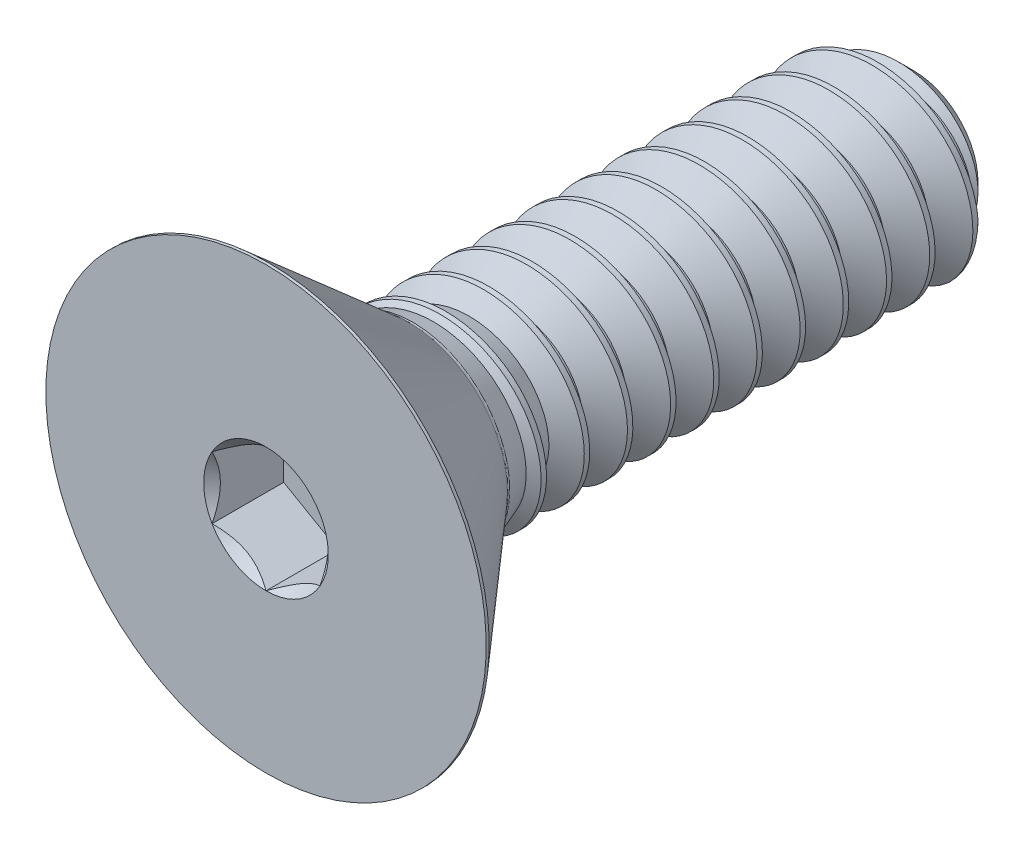
from build123d import *

# Parameters (mm, degrees)
CUT_EXTRUDE1_DEPTH = 1.0541
CUT_SWEEP1_PITCH   = 0.635


with BuildPart() as part:
    # Sketch11 → Revolve1 (revolve)
    with BuildSketch(Plane(origin=(0, 0, 0), x_dir=(0, 0, -1), z_dir=(1, 0, 0))):
        with BuildLine():
            Line((-4.720336, 3.2385), (-2.6543, 1.442522305))
            ThreePointArc((-2.6543, 1.442522305), (-2.629209578, 1.427595073), (-2.60048045, 1.4224))
            Line((-2.60048045, 1.4224), (4.28625, 1.4224))
            Line((4.28625, 1.4224), (4.7625, 0.94615))
            Line((4.7625, 0.94615), (4.7625, 0))
            Line((4.7625, 0), (-4.7625, 0))
            Line((-4.7625, 0), (-4.7625, 3.2385))
            Line((-4.7625, 3.2385), (-4.720336, 3.2385))
        make_face()
    revolve(axis=Axis((0, 0, -4.7625), (0, 0, 1)))

    # Cut-Extrude2 cone 1 section (through the dimple's axis) → Cut-Extrude2 (revolve, cut)
    with BuildSketch(Plane(origin=(0, 0, 4.7625), x_dir=(0, -1, 0), z_dir=(1, 0, 0))):
        Polygon((0, 0), (0.916543552, 0), (0, 0.916543552), align=None)
    revolve(axis=Axis((0, 0, 4.7625), (0, 0, -1)), mode=Mode.SUBTRACT)

    # Sketch9 → Cut-Extrude1 (cut)
    with BuildSketch(Plane.XY.offset(4.7625)):
        Polygon((0.79375, -0.458271776), (0.79375, 0.458271776), (0, 0.916543552), (-0.79375, 0.458271776), (-0.79375, -0.458271776), (0, -0.916543552), align=None)
    extrude(amount=-CUT_EXTRUDE1_DEPTH, mode=Mode.SUBTRACT)


with BuildPart() as body_2:
    # Split1: the piece on the far side of the plane
    add(part.part)
    split(bisect_by=Plane.XY.offset(2.60048045), keep=Keep.BOTTOM)

    # Cut-Sweep1: the profile of Sketch4 screwed along a right-hand helix of 15 turns, 6 arcs to a turn; built about Z, then put on its axis
    cut_sweep1_z = Axis((0, 0, 0), (0, 0, 1))
    cut_sweep1_corners = [(1.456770383, 0, 0.01984375), (1.456770383, 0, -0.57546875), (1.009955401, 0, -0.3175), (1.009955401, 0, -0.238125)]
    with BuildLine(mode=Mode.PRIVATE) as cut_sweep1_profile:
        Line(cut_sweep1_corners[0], cut_sweep1_corners[1])
        Line(cut_sweep1_corners[1], cut_sweep1_corners[2])
        Line(cut_sweep1_corners[2], cut_sweep1_corners[3])
        Line(cut_sweep1_corners[3], cut_sweep1_corners[0])
    cut_sweep1_cap = Face(cut_sweep1_profile.wire())
    cut_sweep1_turn_angles = [0, 30, 60, 90, 120, 150, 180, 210, 240, 270, 300, 330, 360]
    cut_sweep1_turn_weights = [1, 0.8660254037844387, 1, 0.8660254037844387, 1, 0.8660254037844387, 1, 0.8660254037844387, 1, 0.8660254037844387, 1, 0.8660254037844387, 1]
    cut_sweep1_turn_rails = [Edge.make_bspline([Vector(p[0], p[1], 0).rotate(cut_sweep1_z, cut_sweep1_turn_angles[k]) / cut_sweep1_turn_weights[k] + Vector(0, 0, p[2] + CUT_SWEEP1_PITCH * cut_sweep1_turn_angles[k] / 360) for k in range(13)], [0, 0, 0, 1, 1, 2, 2, 3, 3, 4, 4, 5, 5, 6, 6, 6], 2, cut_sweep1_turn_weights) for p in cut_sweep1_corners]
    cut_sweep1_turn_sides = [Face.make_surface_from_curves(cut_sweep1_turn_rails[p[0]], cut_sweep1_turn_rails[p[1]]) for p in [(0, 1), (1, 2), (2, 3), (3, 0)]]
    cut_sweep1_turn = Solid(Shell([*cut_sweep1_turn_sides, cut_sweep1_cap, cut_sweep1_cap.rotate(cut_sweep1_z, 360).moved(Location((0, 0, CUT_SWEEP1_PITCH * 360 / 360)))]))
    cut_sweep1_each = [*[cut_sweep1_turn.moved(Location((0, 0, CUT_SWEEP1_PITCH * i))) for i in range(15)]]
    add(Plane(origin=(0, 0, -4.7625), x_dir=(0, 1, 0), z_dir=(0, 0, 1)) * Compound([cut_sweep1_each[i] for i in range(0, 15, 2)]), mode=Mode.SUBTRACT)
    add(Plane(origin=(0, 0, -4.7625), x_dir=(0, 1, 0), z_dir=(0, 0, 1)) * Compound([cut_sweep1_each[i] for i in range(1, 15, 2)]), mode=Mode.SUBTRACT)


with BuildPart() as part_1:
    add(part.part)

    # Split1
    split(bisect_by=Plane.XY.offset(2.60048045), keep=Keep.TOP)

    add(body_2.part)  # Boss-Extrude2 merges body 2
    # Boss-Extrude2 cone 1 section (through the dimple's axis) → Boss-Extrude2 (revolve)
    with BuildSketch(Plane(origin=(0, 0, 2.60048045), x_dir=(0, -1, 0), z_dir=(1, 0, 0))):
        Polygon((0, 0), (1.4224, 0), (0, 3.908011881), align=None)
    revolve(axis=Axis((0, 0, 2.60048045), (0, 0, -1)))


solid = part_1.part
